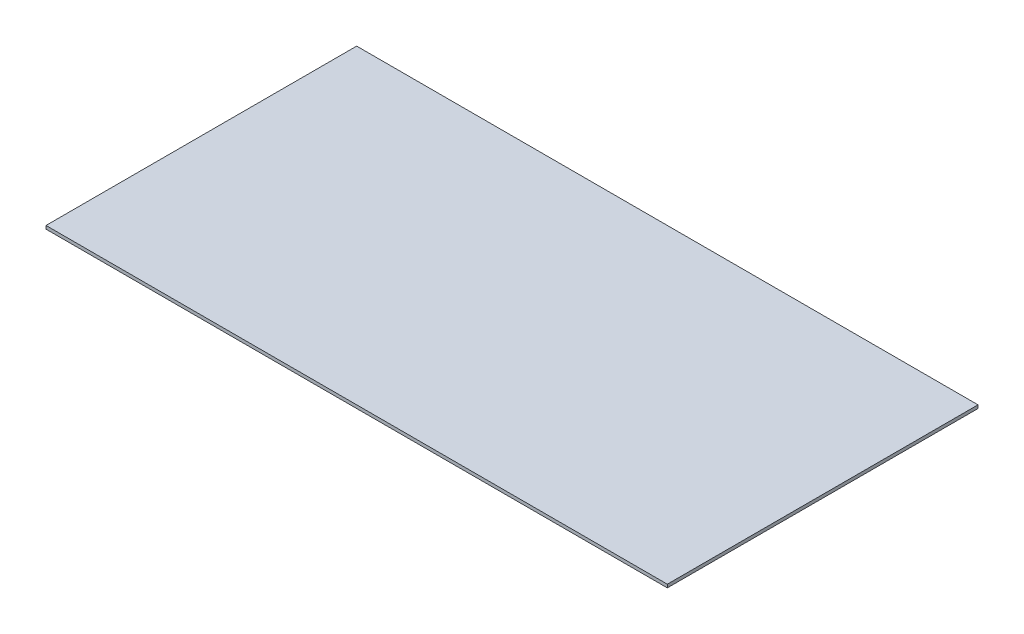
from build123d import *

# Parameters (mm, degrees)
SKETCH1_W           = 609.6
SKETCH1_H           = 304.8
BOSS_EXTRUDE1_DEPTH = 1.5875


with BuildPart() as part:
    # Sketch1 → Boss-Extrude1 (new, symmetric)
    with BuildSketch(Plane(origin=(0, 0, 0), x_dir=(1, 0, 0), z_dir=(0, 1, 0))):
        Rectangle(SKETCH1_W, SKETCH1_H)
    extrude(amount=BOSS_EXTRUDE1_DEPTH, both=True)


solid = part.part
